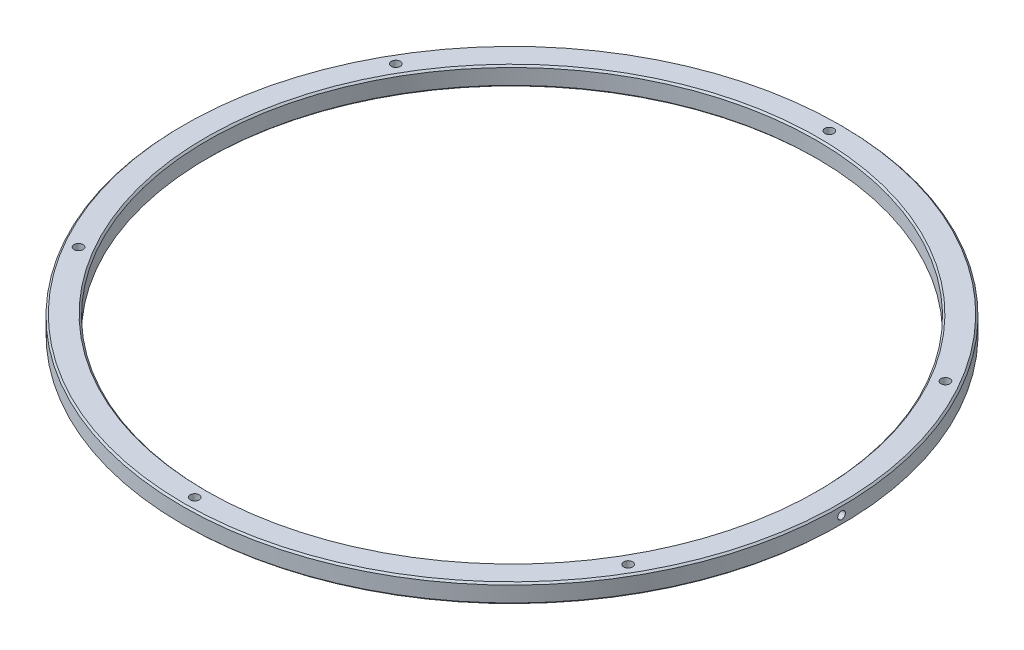
from build123d import *

# Parameters (mm, degrees)
SKETCH1_R            = 175
SKETCH1_R_2          = 161.665
SKETCH1_R_3          = 2.38125
BOSS_EXTRUDE1_DEPTH  = 10
CUT_EXTRUDE1_START   = 171.178202291
CUT_EXTRUDE1_DEPTH   = 4.821797709
CUT_EXTRUDE1_START_2 = 2
CUT_EXTRUDE1_2_DEPTH = 6
CHAMFER1_SIZE        = 0.889


with BuildPart() as part:
    # Sketch1 → Boss-Extrude1 (new body)
    with BuildSketch(Plane(origin=(0, 0, 0), x_dir=(1, 0, 0), z_dir=(0, 1, 0))):
        with Locations(Location((0, 0, 0), (0, 0, 270))):
            Circle(SKETCH1_R)
        with Locations(Location((0, 0, 0), (0, 0, 270))):
            Circle(SKETCH1_R_2, mode=Mode.SUBTRACT)
        with Locations(Location((0, 168.5, 0), (0, 0, 270))):
            Circle(SKETCH1_R_3, mode=Mode.SUBTRACT)
        with Locations(Location((145.925280538, 84.25, 0), (0, 0, 270))):
            Circle(SKETCH1_R_3, mode=Mode.SUBTRACT)
        with Locations(Location((145.925280538, -84.25, 0), (0, 0, 270))):
            Circle(SKETCH1_R_3, mode=Mode.SUBTRACT)
        with Locations(Location((0, -168.5, 0), (0, 0, 270))):
            Circle(SKETCH1_R_3, mode=Mode.SUBTRACT)
        with Locations(Location((-145.925280538, -84.25, 0), (0, 0, 270))):
            Circle(SKETCH1_R_3, mode=Mode.SUBTRACT)
        with Locations(Location((-145.925280538, 84.25, 0), (0, 0, 270))):
            Circle(SKETCH1_R_3, mode=Mode.SUBTRACT)
    extrude(amount=BOSS_EXTRUDE1_DEPTH)

    # Cut-Extrude1: read off the stored shape, not the designer's step
    # Cut-Extrude1 outline → Cut-Extrude1 (cut)
    with BuildSketch(Plane(origin=(0, 0, 0), x_dir=(0, 0, -1), z_dir=(1, 0, 0)).offset(CUT_EXTRUDE1_START)):
        with BuildLine():
            add(Edge.make_bspline(
                [(-2.032, 5), (-2.032, 4.463019904), (-1.811680416, 3.937931056), (-1.061743192, 3.188128657), (-0.531157275, 2.968281859), (0.528998518, 2.967718714), (1.056585006, 3.183292038), (1.81562455, 3.941554355), (2.031812274, 4.468847604), (2.032187472, 5.529715077), (1.812580645, 6.060372732), (1.063888553, 6.810519282), (0.538021986, 7.031452247), (-0.533876497, 7.032545639), (-1.06018224, 6.812899427), (-1.811203542, 6.063076876), (-2.032, 5.536980096), (-2.032, 5)],
                knots=[0, 0, 0, 0, 0.125, 0.125, 0.25, 0.25, 0.375, 0.375, 0.5, 0.5, 0.625, 0.625, 0.75, 0.75, 0.875, 0.875, 1, 1, 1, 1], degree=3))
        make_face()
    extrude(amount=CUT_EXTRUDE1_DEPTH, mode=Mode.SUBTRACT)

    # Cut-Extrude1 2 outline → Cut-Extrude1 2 (add)
    with BuildSketch(Plane(origin=(0, 0, 0), x_dir=(1, 0, 0), z_dir=(0, 1, 0)).offset(CUT_EXTRUDE1_START_2)):
        with BuildLine():
            ThreePointArc((171.178202391, -2.032), (171.19, 4.7e-08), (171.17820239, 2.032000094))
            Line((171.17820239, 2.032000094), (171.178202391, -2.032))
        make_face()
    extrude(amount=CUT_EXTRUDE1_2_DEPTH)

    # Chamfer1
    chamfer1_edges = [part.edges().sort_by_distance(p)[0] for p in [
        (0, 0, -175),
        (0, 10, -175),
        (0, 0, -161.665),
        (0, 10, -161.665),
    ]]
    chamfer(chamfer1_edges, length=CHAMFER1_SIZE)


solid = part.part
